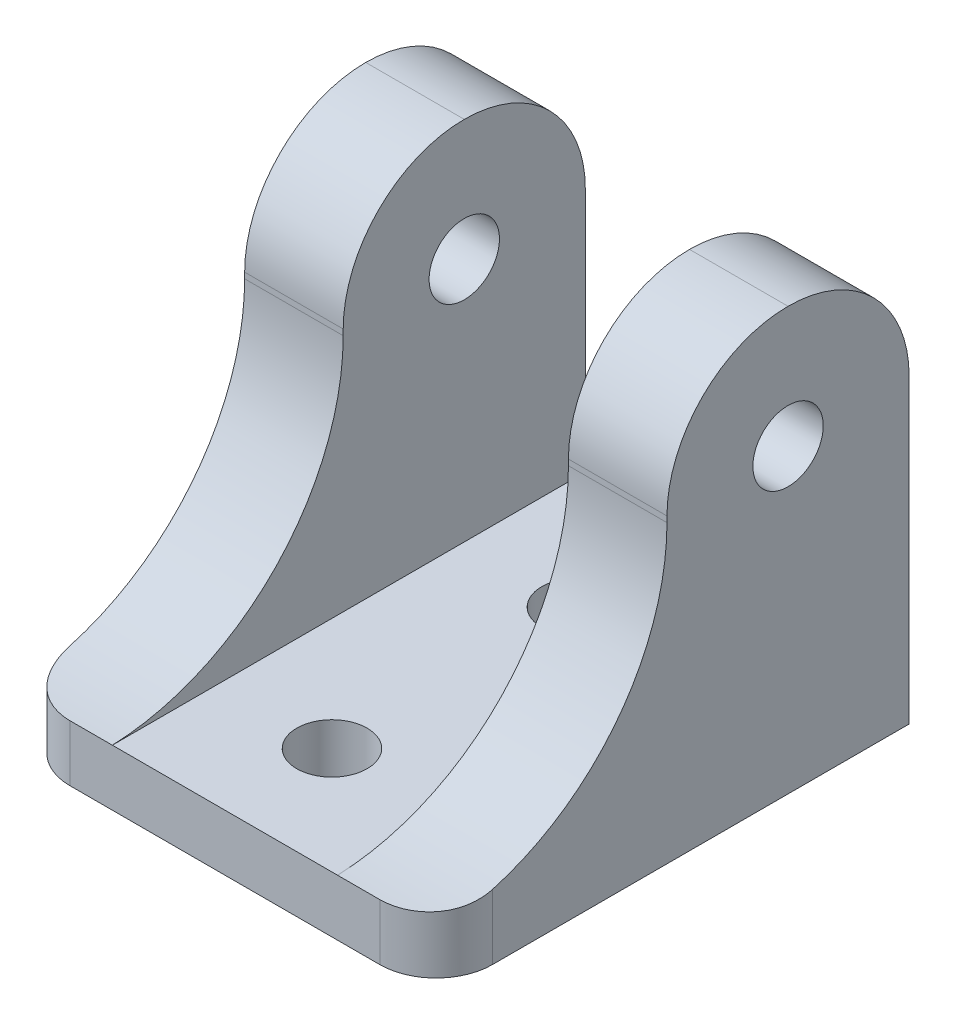
from build123d import *

# Parameters (mm, degrees)
SKETCH1_W                            = 38.1
SKETCH1_H                            = 42.672
BOSS_EXTRUDE1_DEPTH                  = 5.08
SKETCH2_W                            = 8.89
SKETCH2_H                            = 21.844
BOSS_EXTRUDE2_DEPTH                  = 33.02
FILLET1_R                            = 10.922
FILLET2_R                            = 21.59
FILLET3_R                            = 5.08
F_1_1_DIAMETER_HOLE1_D               = 6.35
F_1_1_DIAMETER_HOLE1_DEPTH           = 50.8
F_1_1_DIAMETER_HOLE1_TIP             = 1.907732465
F_1_1_DIAMETER_HOLE1_ON_FACE_2_D     = 6.35
F_1_1_DIAMETER_HOLE1_ON_FACE_2_DEPTH = 50.8
F_1_1_DIAMETER_HOLE1_ON_FACE_2_TIP   = 1.907732465


# Some blends are built 0.0001 mm under size
with BuildPart() as part:
    # Sketch1 → Boss-Extrude1 (new body)
    with BuildSketch(Plane(origin=(0, 0, 0), x_dir=(1, 0, 0), z_dir=(0, 1, 0))):
        with Locations((1.652063174, -2.269767862)):
            Rectangle(SKETCH1_W, SKETCH1_H)
    extrude(amount=BOSS_EXTRUDE1_DEPTH)

    # Sketch2 → Boss-Extrude2 (add)
    with BuildSketch(Plane(origin=(0, 5.08, 0), x_dir=(1, 0, 0), z_dir=(0, 1, 0))):
        with Locations((16.257063174, 8.144232138)):
            Rectangle(SKETCH2_W, SKETCH2_H)
        with Locations((-12.952936826, 8.144232138)):
            Rectangle(SKETCH2_W, SKETCH2_H)
    extrude(amount=BOSS_EXTRUDE2_DEPTH)

    # Fillet1
    fillet1_edges = [part.edges().sort_by_distance(p)[0] for p in [
        (-12.952936826, 38.1, -19.066232138),
        (16.257063174, 38.1, -19.066232138),
        (16.257063174, 38.1, 2.777767862),
        (-12.952936826, 38.1, 2.777767862),
    ]]
    fillet(fillet1_edges, radius=FILLET1_R - 0.0001)  # a hair under: the kernel refuses the full size

    # Fillet2
    # the kernel refuses this fillet: 21.59 mm, written as the material it adds along each edge
    with BuildSketch(Plane(origin=(-42.129308703, 5.08, 2.777767862), x_dir=(0, 0, 1), z_dir=(1, 0, 0))) as fillet2_piece_1_section:
        with BuildLine():
            CenterArc((21.59, -21.576548751), FILLET2_R, 92.022624053, 87.977375947)
            Line((0, -21.576548751), (-0.4318, -21.576548751))
            Line((-0.4318, -21.576548751), (-0.4318, 0))
            Line((-0.4318, 0), (0, 0.4318))
            ThreePointArc((0, 0.4318), (10.414, 0.4318), (20.81276, 0.431530975))
            Line((20.81276, 0.431530975), (20.828, 0))
        make_face()
    fillet2_piece_1 = extrude(amount=62.831371877, mode=Mode.PRIVATE)
    fillet2_piece_1 = split(fillet2_piece_1, bisect_by=Plane(origin=(-17.397936826, 9.985892861, 7.610379984), z_dir=(1, 0, 0)), keep=Keep.TOP, mode=Mode.PRIVATE)
    fillet2_piece_1 = split(fillet2_piece_1, bisect_by=Plane(origin=(-8.507936826, 9.985892861, 7.610379984), z_dir=(-1, 0, 0)), keep=Keep.TOP, mode=Mode.PRIVATE)
    add(fillet2_piece_1)
    with BuildSketch(Plane(origin=(11.812063174, 5.08, 2.777767862), x_dir=(0, 0, 1), z_dir=(1, 0, 0))) as fillet2_piece_2:
        with BuildLine():
            CenterArc((21.59, -21.576548751), FILLET2_R, 92.022624053, 87.977375947)
            Line((0, -21.576548751), (-0.4318, -21.576548751))
            Line((-0.4318, -21.576548751), (-0.4318, 0))
            Line((-0.4318, 0), (0, 0.4318))
            ThreePointArc((0, 0.4318), (10.414, 0.4318), (20.81276, 0.431530975))
            Line((20.81276, 0.431530975), (20.828, 0))
        make_face()
    extrude(amount=8.89)
    with BuildSketch(Plane(origin=(45.433435051, 5.08, 2.777767862), x_dir=(0, 0, 1), z_dir=(-1, 0, 0))) as fillet2_piece_3_section:
        with BuildLine():
            CenterArc((21.59, 21.576548751), FILLET2_R, 180, 87.977375947)
            Line((0, 21.576548751), (-0.4318, 21.576548751))
            Line((-0.4318, 21.576548751), (-0.4318, 0))
            Line((-0.4318, 0), (0, -0.4318))
            ThreePointArc((0, -0.4318), (10.414, -0.4318), (20.81276, -0.431530975))
            Line((20.81276, -0.431530975), (20.828, 0))
        make_face()
    fillet2_piece_3 = extrude(amount=62.831371877, mode=Mode.PRIVATE)
    fillet2_piece_3 = split(fillet2_piece_3, bisect_by=Plane(origin=(20.702063174, 9.985892861, 7.610379984), z_dir=(-1, 0, 0)), keep=Keep.TOP, mode=Mode.PRIVATE)
    fillet2_piece_3 = split(fillet2_piece_3, bisect_by=Plane(origin=(11.812063174, 9.985892861, 7.610379984), z_dir=(1, 0, 0)), keep=Keep.TOP, mode=Mode.PRIVATE)
    add(fillet2_piece_3)
    with BuildSketch(Plane(origin=(-8.507936826, 5.08, 2.777767862), x_dir=(0, 0, 1), z_dir=(-1, 0, 0))) as fillet2_piece_4:
        with BuildLine():
            CenterArc((21.59, 21.576548751), FILLET2_R, 180, 87.977375947)
            Line((0, 21.576548751), (-0.4318, 21.576548751))
            Line((-0.4318, 21.576548751), (-0.4318, 0))
            Line((-0.4318, 0), (0, -0.4318))
            ThreePointArc((0, -0.4318), (10.414, -0.4318), (20.81276, -0.431530975))
            Line((20.81276, -0.431530975), (20.828, 0))
        make_face()
    extrude(amount=8.89)

    # Fillet3
    fillet3_edges = [part.edges().sort_by_distance(p)[0] for p in [
        (20.702063174, 2.54, 23.605767862),
        (-17.397936826, 2.54, 23.605767862),
    ]]
    fillet(fillet3_edges, radius=FILLET3_R)

    # 1 (1) Diameter Hole1
    with Locations(Plane(origin=(1.652063174, 5.08, 13.953767862), x_dir=(0, 0, 1), z_dir=(0, 1, 0))):
        with Locations((0, 0), (-22.098, 0)):
            Hole(F_1_1_DIAMETER_HOLE1_D / 2, depth=F_1_1_DIAMETER_HOLE1_DEPTH)
            with Locations((0, 0, -(F_1_1_DIAMETER_HOLE1_DEPTH + F_1_1_DIAMETER_HOLE1_TIP / 2))):  # 118° drill point
                Cone(0, F_1_1_DIAMETER_HOLE1_D / 2, F_1_1_DIAMETER_HOLE1_TIP, mode=Mode.SUBTRACT)

    # 1 (1) Diameter Hole1 on face 2
    with Locations(Plane(origin=(20.702063174, 27.178, -8.144232138), x_dir=(0, 0, 1), z_dir=(1, 0, 0))):
        with Locations((0, 0)):
            Hole(F_1_1_DIAMETER_HOLE1_ON_FACE_2_D / 2, depth=F_1_1_DIAMETER_HOLE1_ON_FACE_2_DEPTH)
            with Locations((0, 0, -(F_1_1_DIAMETER_HOLE1_ON_FACE_2_DEPTH + F_1_1_DIAMETER_HOLE1_ON_FACE_2_TIP / 2))):  # 118° drill point
                Cone(0, F_1_1_DIAMETER_HOLE1_ON_FACE_2_D / 2, F_1_1_DIAMETER_HOLE1_ON_FACE_2_TIP, mode=Mode.SUBTRACT)


solid = part.part
